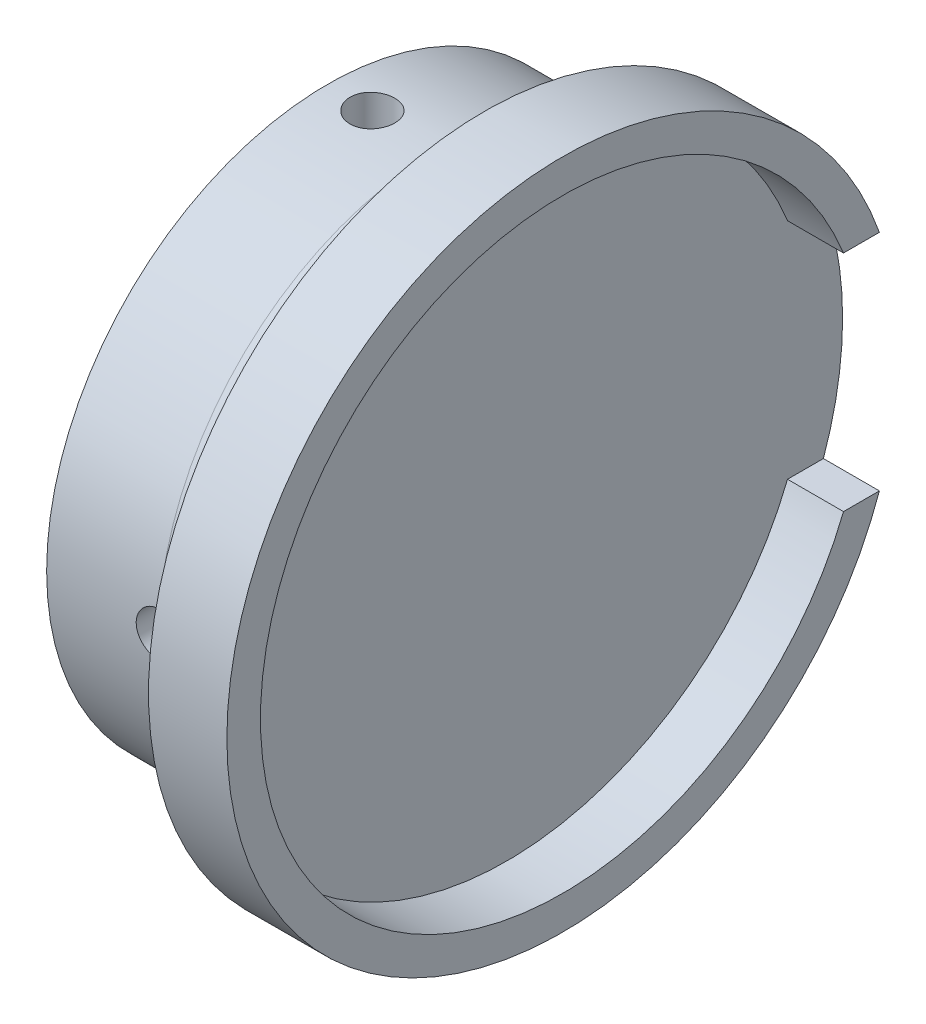
from build123d import *

# Parameters (mm, degrees)
SKETCH_1_R                      = 12.55
EXTRUDE_1_DEPTH                 = 8
SKETCH_2_R                      = 3
CUT_EXTRUDE_1_DEPTH             = 7
CUT_EXTRUDE_2_REACH             = 21.468
SKETCH_3_R                      = 1
CUT_EXTRUDE_2_DIRECTION_2_REACH = 21.468
CUT_EXTRUDE_3_DEPTH             = 21
CUT_EXTRUDE_3_DEPTH_BACK        = 19
SKETCH_4_R                      = 1
EXTRUDE_2_DEPTH                 = 2.5
EXTRUDE_2_DEPTH_BACK            = 1
SKETCH_5_R                      = 15
SKETCH_6_R                      = 13.5
CUT_EXTRUDE_4_DEPTH             = 2.5
FILLET_1_R                      = 2
SKETCH_7_W                      = 2.5
SKETCH_7_H                      = 10
CUT_EXTRUDE_5_DEPTH             = 21.5


with BuildPart() as part:
    # 草图1 → 凸台-拉伸1 (new body)
    with BuildSketch(Plane(origin=(0, 0, 0), x_dir=(0, 0, -1), z_dir=(1, 0, 0))):
        Circle(SKETCH_1_R)
    extrude(amount=EXTRUDE_1_DEPTH)

    # 草图2 → 切除-拉伸1 (cut)
    with BuildSketch(Plane.ZY):
        Circle(SKETCH_2_R)
    extrude(amount=-CUT_EXTRUDE_1_DEPTH, mode=Mode.SUBTRACT)

    # 草图3 → 切除-拉伸2 (cut, up to next)
    with BuildSketch(Plane(origin=(0, 0, 0), x_dir=(1, 0, 0), z_dir=(0, 1, 0)), mode=Mode.PRIVATE) as cut_extrude_2_sk1:
        with Locations(Location((2, 0, 0), (0, 0, 270))):
            Circle(SKETCH_3_R)
    cut_extrude_2_tool1 = extrude(cut_extrude_2_sk1.sketch, amount=-CUT_EXTRUDE_2_REACH, mode=Mode.PRIVATE) & part.part
    add(cut_extrude_2_tool1.solids().sort_by_distance((2, 0, 0))[0], mode=Mode.SUBTRACT)

    # 草图3 → 切除-拉伸2 direction 2 (cut, up to next)
    with BuildSketch(Plane(origin=(0, 0, 0), x_dir=(1, 0, 0), z_dir=(0, 1, 0)), mode=Mode.PRIVATE) as cut_extrude_2_direction_2_sk1:
        with Locations(Location((2, 0, 0), (0, 0, 270))):
            Circle(SKETCH_3_R)
    cut_extrude_2_direction_2_tool1 = extrude(cut_extrude_2_direction_2_sk1.sketch, amount=CUT_EXTRUDE_2_DIRECTION_2_REACH, mode=Mode.PRIVATE) & part.part
    add(cut_extrude_2_direction_2_tool1.solids().sort_by_distance((2, 0, 0))[0], mode=Mode.SUBTRACT)

    # 草图4 → 切除-拉伸3 (cut, two sides: drawn at the far end of the back side and taken through both)
    with BuildSketch(Plane.XY.offset(-CUT_EXTRUDE_3_DEPTH_BACK)):
        with Locations(Location((5, 0, 0), (0, 0, 180))):
            Circle(SKETCH_4_R)
    extrude(amount=CUT_EXTRUDE_3_DEPTH + CUT_EXTRUDE_3_DEPTH_BACK, mode=Mode.SUBTRACT)

    # 草图5 → 凸台-拉伸2 (add, two sides: drawn at the far end of the back side and taken through both)
    with BuildSketch(Plane(origin=(8, 0, 0), x_dir=(0, 0, -1), z_dir=(1, 0, 0)).offset(-EXTRUDE_2_DEPTH_BACK)):
        Circle(SKETCH_5_R)
    extrude(amount=EXTRUDE_2_DEPTH + EXTRUDE_2_DEPTH_BACK)

    # 草图6 → 切除-拉伸4 (cut)
    with BuildSketch(Plane(origin=(10.5, 0, 0), x_dir=(0, 0, -1), z_dir=(1, 0, 0))):
        Circle(SKETCH_6_R)
    extrude(amount=-CUT_EXTRUDE_4_DEPTH, mode=Mode.SUBTRACT)

    # 圆角1
    # the kernel refuses this fillet: 2 mm, written as the material it adds along each edge
    with BuildSketch(Plane(origin=(7, 0, 0), x_dir=(0, 0, -1), z_dir=(0, 1, 0))) as fillet_1_piece_1_section:
        with BuildLine():
            CenterArc((12.55 + FILLET_1_R, FILLET_1_R), FILLET_1_R, 180, 90)
            Line((12.55 + FILLET_1_R, 0), (12.55, 0))
            Line((12.55, 0), (12.55, FILLET_1_R))
        make_face()
    fillet_1_piece_1 = revolve(axis=Axis((7, 0, 0), (-1, 0, 0)), mode=Mode.PRIVATE)
    fillet_1_piece_1 = fillet_1_piece_1 - Plane(origin=(5, 0, 13.104940956), x_dir=(-1, 0, 0), z_dir=(0, 0, 1)) * Cylinder(1, 59, mode=Mode.PRIVATE)
    add(fillet_1_piece_1)

    # 草图7 → 切除-拉伸5 (cut)
    with BuildSketch(Plane.XY):
        with Locations((9.25, 0)):
            Rectangle(SKETCH_7_W, SKETCH_7_H)
    extrude(amount=-CUT_EXTRUDE_5_DEPTH, mode=Mode.SUBTRACT)


solid = part.part
